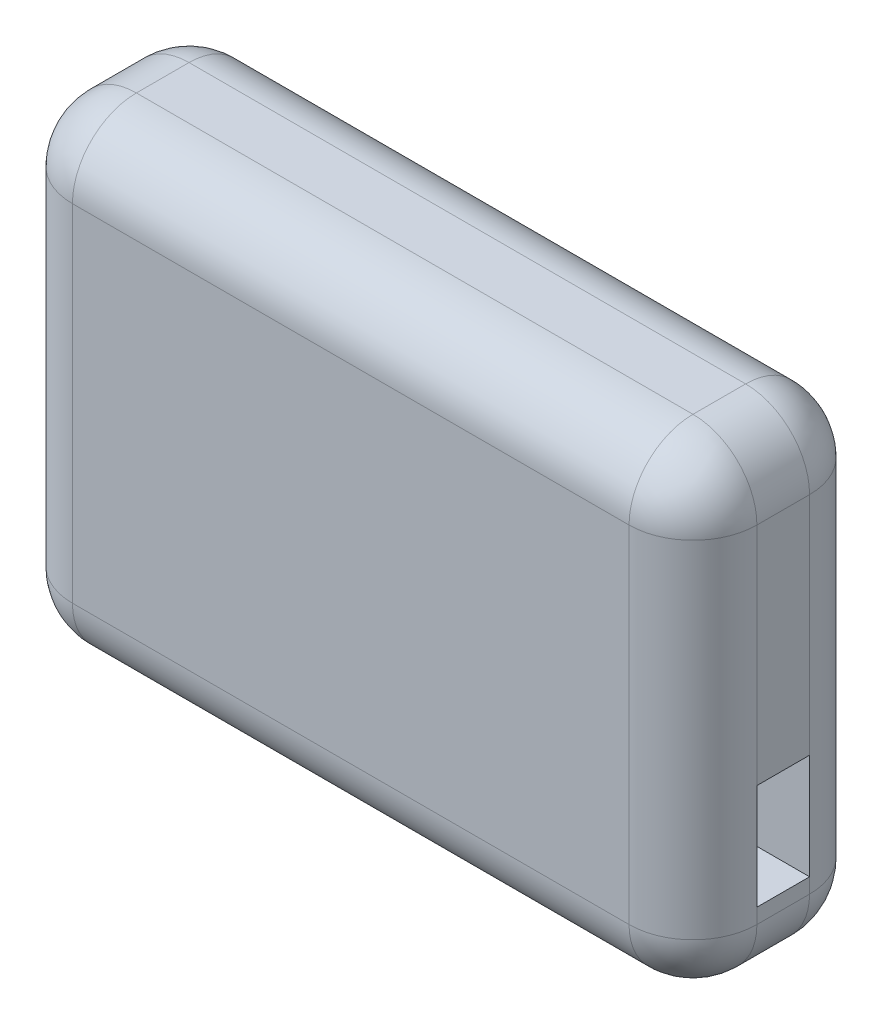
from build123d import *

# Parameters (mm, degrees)
BOSS_EXTRUDE1_DEPTH      = 12
BOSS_EXTRUDE1_DEPTH_BACK = 12
SKETCH1_W                = 91
SKETCH1_H                = 63
FILLET1_R                = 8.5
FILLET2_R                = 8.5
SKETCH2_W                = 7
SKETCH2_H                = 14
CUT_EXTRUDE1_DEPTH       = 12


with BuildPart() as part:
    # Sketch1 → Boss-Extrude1 (new, two sides: drawn at the far end of the back side and taken through both)
    with BuildSketch(Plane.XY.offset(-BOSS_EXTRUDE1_DEPTH_BACK)):
        Rectangle(SKETCH1_W, SKETCH1_H)
    extrude(amount=BOSS_EXTRUDE1_DEPTH + BOSS_EXTRUDE1_DEPTH_BACK)

    # Fillet1
    fillet1_edges = [part.edges().sort_by_distance(p)[0] for p in [
        (45.5, 0, 12),
        (-45.5, 0, -12),
        (0, 31.5, 12),
        (-45.5, 0, 12),
        (0, -31.5, 12),
        (0, -31.5, -12),
        (45.5, 0, -12),
        (0, 31.5, -12),
    ]]
    fillet(fillet1_edges, radius=FILLET1_R)

    # Fillet2
    # the kernel refuses this fillet: 8.5 mm, written as the material it takes off along each edge
    with BuildSketch(Plane(origin=(37, -23, -3.5), x_dir=(1, 0, 0), z_dir=(0, -1, 0))) as fillet2_piece_1_section:
        Polygon((0, 0), (FILLET2_R, 0), (FILLET2_R, -FILLET2_R), (0, -FILLET2_R), align=None)
    fillet2_piece_1 = extrude(amount=FILLET2_R, mode=Mode.PRIVATE)
    fillet2_piece_1 = fillet2_piece_1 - Plane(origin=(37, -23, -3.5), x_dir=(-0.7071067811865475, 0, 0.7071067811865475), z_dir=(0, -1, 0)) * Sphere(FILLET2_R, mode=Mode.PRIVATE)
    add(fillet2_piece_1, mode=Mode.SUBTRACT)
    with BuildSketch(Plane(origin=(-37, -23, -3.5), x_dir=(-1, 0, 0), z_dir=(0, -1, 0))) as fillet2_piece_2_section:
        Polygon((0, 0), (FILLET2_R, 0), (FILLET2_R, FILLET2_R), (0, FILLET2_R), align=None)
    fillet2_piece_2 = extrude(amount=FILLET2_R, mode=Mode.PRIVATE)
    fillet2_piece_2 = fillet2_piece_2 - Plane(origin=(-37, -23, -3.5), x_dir=(0.7071067811865475, 0, 0.7071067811865475), z_dir=(0, -1, 0)) * Sphere(FILLET2_R, mode=Mode.PRIVATE)
    add(fillet2_piece_2, mode=Mode.SUBTRACT)
    with BuildSketch(Plane(origin=(37, 23, -3.5), x_dir=(0, 1, 0), z_dir=(1, 0, 0))) as fillet2_piece_3_section:
        Polygon((0, 0), (FILLET2_R, 0), (FILLET2_R, -FILLET2_R), (0, -FILLET2_R), align=None)
    fillet2_piece_3 = extrude(amount=FILLET2_R, mode=Mode.PRIVATE)
    fillet2_piece_3 = fillet2_piece_3 - Plane(origin=(37, 23, -3.5), x_dir=(0, -0.7071067811865475, 0.7071067811865475), z_dir=(1, 0, 0)) * Sphere(FILLET2_R, mode=Mode.PRIVATE)
    add(fillet2_piece_3, mode=Mode.SUBTRACT)
    with BuildSketch(Plane(origin=(-37, 23, -3.5), x_dir=(0, 1, 0), z_dir=(-1, 0, 0))) as fillet2_piece_4_section:
        Polygon((0, 0), (FILLET2_R, 0), (FILLET2_R, FILLET2_R), (0, FILLET2_R), align=None)
    fillet2_piece_4 = extrude(amount=FILLET2_R, mode=Mode.PRIVATE)
    fillet2_piece_4 = fillet2_piece_4 - Plane(origin=(-37, 23, -3.5), x_dir=(0, -0.7071067811865475, 0.7071067811865475), z_dir=(-1, 0, 0)) * Sphere(FILLET2_R, mode=Mode.PRIVATE)
    add(fillet2_piece_4, mode=Mode.SUBTRACT)
    with BuildSketch(Plane(origin=(-37, 23, 3.5), x_dir=(0, 1, 0), z_dir=(-1, 0, 0))) as fillet2_piece_5_section:
        Polygon((0, 0), (FILLET2_R, 0), (FILLET2_R, -FILLET2_R), (0, -FILLET2_R), align=None)
    fillet2_piece_5 = extrude(amount=FILLET2_R, mode=Mode.PRIVATE)
    fillet2_piece_5 = fillet2_piece_5 - Plane(origin=(-37, 23, 3.5), x_dir=(0, -0.7071067811865475, -0.7071067811865475), z_dir=(-1, 0, 0)) * Sphere(FILLET2_R, mode=Mode.PRIVATE)
    add(fillet2_piece_5, mode=Mode.SUBTRACT)
    with BuildSketch(Plane(origin=(37, 23, 3.5), x_dir=(0, 1, 0), z_dir=(1, 0, 0))) as fillet2_piece_6_section:
        Polygon((0, 0), (FILLET2_R, 0), (FILLET2_R, FILLET2_R), (0, FILLET2_R), align=None)
    fillet2_piece_6 = extrude(amount=FILLET2_R, mode=Mode.PRIVATE)
    fillet2_piece_6 = fillet2_piece_6 - Plane(origin=(37, 23, 3.5), x_dir=(0, -0.7071067811865475, -0.7071067811865475), z_dir=(1, 0, 0)) * Sphere(FILLET2_R, mode=Mode.PRIVATE)
    add(fillet2_piece_6, mode=Mode.SUBTRACT)
    with BuildSketch(Plane(origin=(-37, -23, 3.5), x_dir=(-1, 0, 0), z_dir=(0, -1, 0))) as fillet2_piece_7_section:
        Polygon((0, 0), (FILLET2_R, 0), (FILLET2_R, -FILLET2_R), (0, -FILLET2_R), align=None)
    fillet2_piece_7 = extrude(amount=FILLET2_R, mode=Mode.PRIVATE)
    fillet2_piece_7 = fillet2_piece_7 - Plane(origin=(-37, -23, 3.5), x_dir=(0.7071067811865475, 0, -0.7071067811865475), z_dir=(0, -1, 0)) * Sphere(FILLET2_R, mode=Mode.PRIVATE)
    add(fillet2_piece_7, mode=Mode.SUBTRACT)
    with BuildSketch(Plane(origin=(37, -23, 3.5), x_dir=(1, 0, 0), z_dir=(0, -1, 0))) as fillet2_piece_8_section:
        Polygon((0, 0), (FILLET2_R, 0), (FILLET2_R, FILLET2_R), (0, FILLET2_R), align=None)
    fillet2_piece_8 = extrude(amount=FILLET2_R, mode=Mode.PRIVATE)
    fillet2_piece_8 = fillet2_piece_8 - Plane(origin=(37, -23, 3.5), x_dir=(-0.7071067811865475, 0, -0.7071067811865475), z_dir=(0, -1, 0)) * Sphere(FILLET2_R, mode=Mode.PRIVATE)
    add(fillet2_piece_8, mode=Mode.SUBTRACT)
    with BuildSketch(Plane(origin=(-45.5, 31.5, 3.5), x_dir=(0, -1, 0), z_dir=(0, 0, -1)), Plane(origin=(45.5, 31.5, -3.5), x_dir=(0, -1, 0), z_dir=(0, 0, 1)), Plane(origin=(-45.5, -31.5, 3.5), x_dir=(1, 0, 0), z_dir=(0, 0, -1)), Plane(origin=(45.5, -31.5, -3.5), x_dir=(-1, 0, 0), z_dir=(0, 0, 1))) as fillet2_piece_9:
        with BuildLine():
            CenterArc((FILLET2_R, -FILLET2_R), FILLET2_R, 90, 90)
            Line((0, -FILLET2_R), (0, 0))
            Line((0, 0), (FILLET2_R, 0))
        make_face()
    extrude(amount=7, mode=Mode.SUBTRACT)

    # Sketch2 → Cut-Extrude1 (cut)
    with BuildSketch(Plane(origin=(45.5, 0, 0), x_dir=(0, 0, -1), z_dir=(1, 0, 0))):
        with Locations((0, -14)):
            Rectangle(SKETCH2_W, SKETCH2_H)
    extrude(amount=-CUT_EXTRUDE1_DEPTH, mode=Mode.SUBTRACT)


solid = part.part
